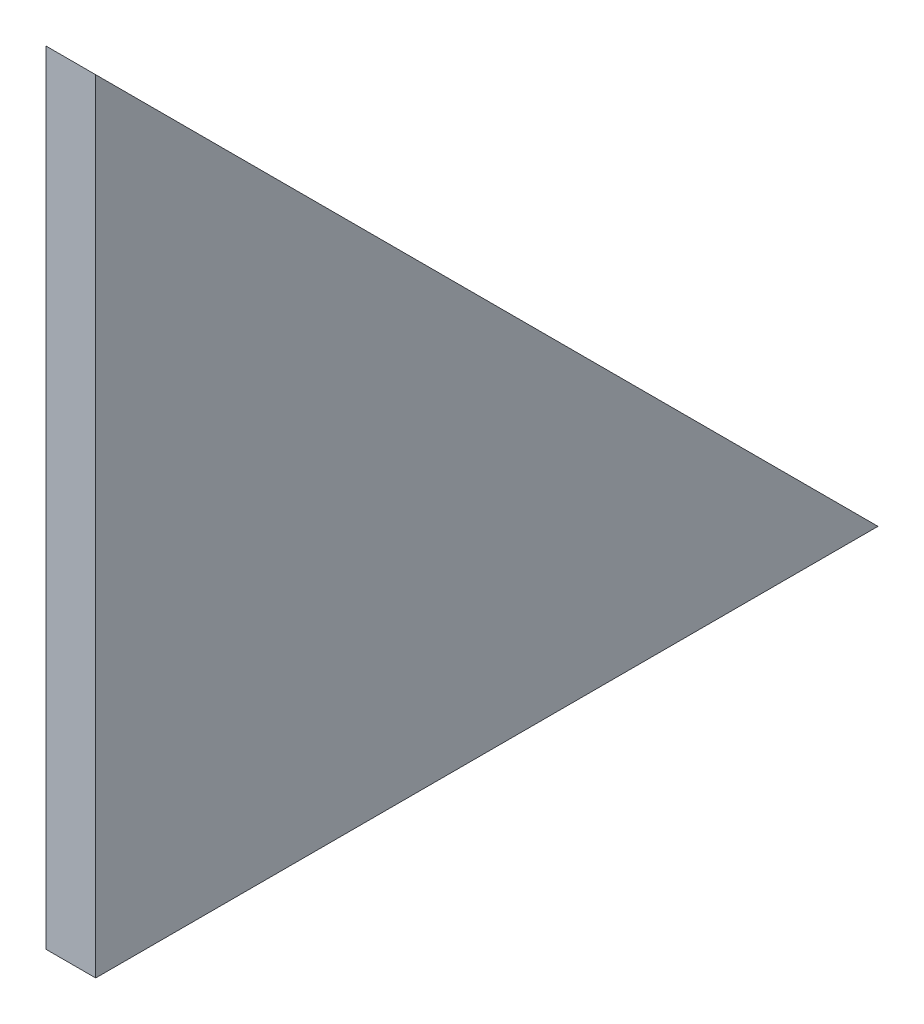
from build123d import *

# Parameters (mm, degrees)
CROQUIS1_W              = 6.35
CROQUIS1_H              = 100
SALIENTE_EXTRUIR1_DEPTH = 50
CORTAR_EXTRUIR2_DEPTH   = 100


with BuildPart() as part:
    # Croquis1 → Saliente-Extruir1 (new, symmetric)
    with BuildSketch(Plane.XY):
        Rectangle(CROQUIS1_W, CROQUIS1_H)
    extrude(amount=SALIENTE_EXTRUIR1_DEPTH, both=True)

    # Croquis3 → Cortar-Extruir2 (cut)
    with BuildSketch(Plane.ZY.offset(3.175)):
        Polygon((-50, -50), (50, 50), (-50, 50), align=None)
    extrude(amount=-CORTAR_EXTRUIR2_DEPTH, mode=Mode.SUBTRACT)


solid = part.part
